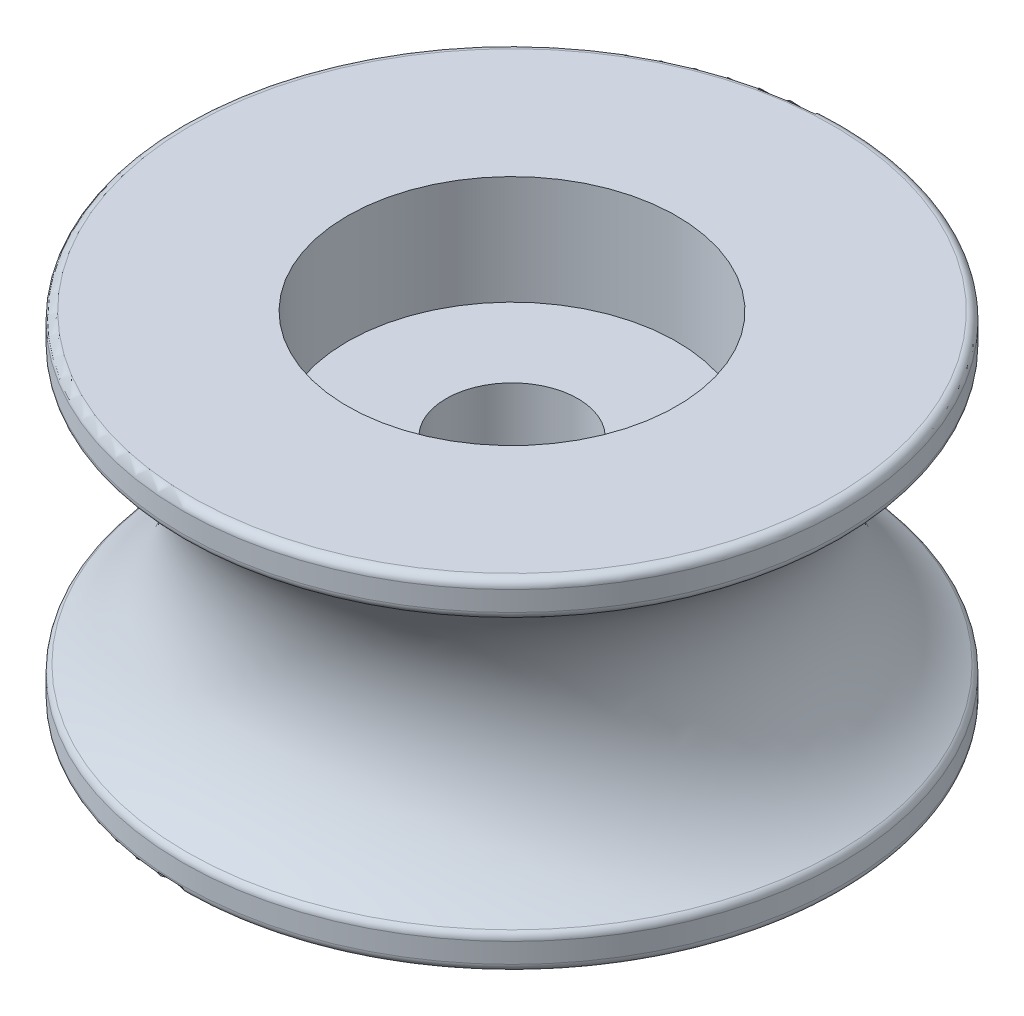
from build123d import *

# Parameters (mm, degrees)
RACCORDO1_R = 0.5


with BuildPart() as part:
    # Schizzo5 → Rivoluzione12 (revolve)
    with BuildSketch(Plane.XY):
        with BuildLine():
            Line((20, 10.35), (20, 8.35))
            ThreePointArc((20, 8.35), (14.99677569, 0), (20, -8.35))
            Line((20, -8.35), (20, -10.35))
            Line((20, -10.35), (10, -10.35))
            Line((10, -10.35), (10, -3.75))
            Line((10, -3.75), (4, -3.75))
            Line((4, -3.75), (4, 3.75))
            Line((4, 3.75), (10, 3.75))
            Line((10, 3.75), (10, 10.35))
            Line((10, 10.35), (20, 10.35))
        make_face()
    revolve(axis=Axis((0, 10.35, 0), (0, -1, 0)))

    # Raccordo1
    raccordo1_edges = [part.edges().sort_by_distance(p)[0] for p in [
        (-20, -10.35, 0),
        (-20, -8.35, 0),
        (-20, 10.35, 0),
        (-20, 8.35, 0),
    ]]
    fillet(raccordo1_edges, radius=RACCORDO1_R)


solid = part.part
